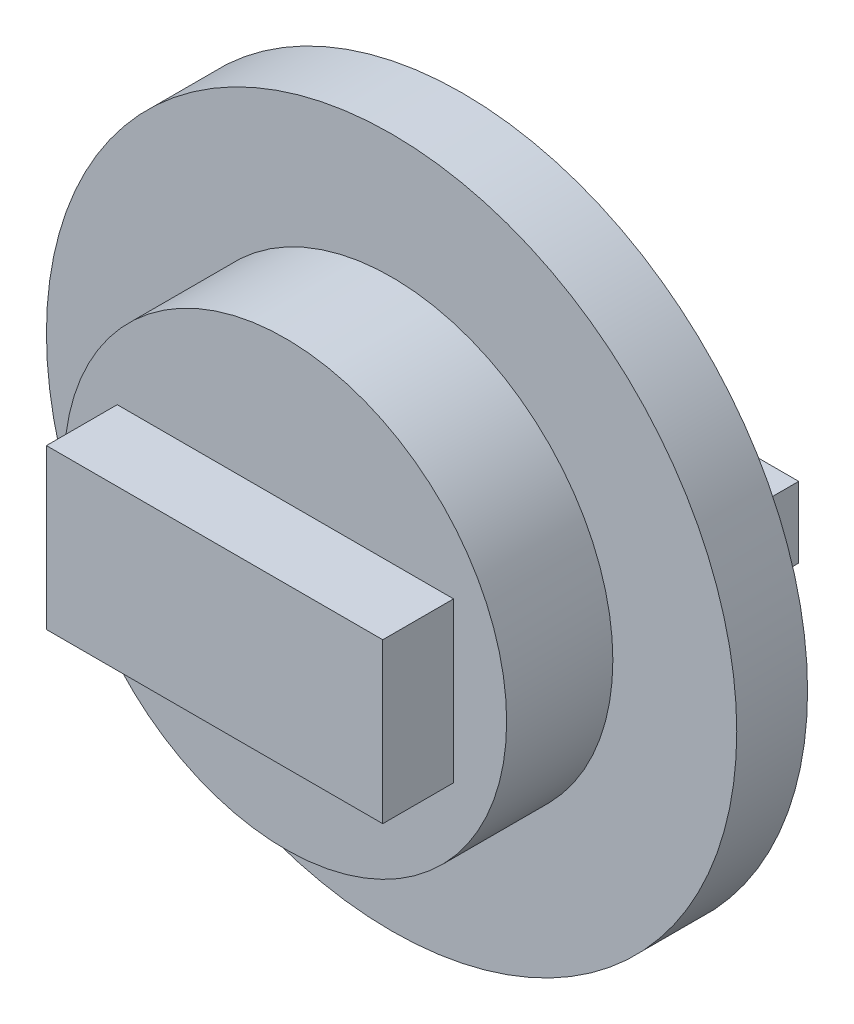
from build123d import *

# Parameters (mm, degrees)
SKETCH_1_R      = 9.75
EXTRUDE_1_DEPTH = 2
EXTRUDE_START   = 2
SKETCH_2_R      = 6.25
EXTRUDE_2_DEPTH = 3
EXTRUDE_START_2 = 5
SKETCH_3_W      = 9.5
SKETCH_3_H      = 4.5
EXTRUDE_3_DEPTH = 2
SKETCH_4_W      = 15
SKETCH_4_H      = 2
EXTRUDE_4_DEPTH = 2


with BuildPart() as part:
    # Эскиз1 → Бобышка-Вытянуть1 (new body)
    with BuildSketch(Plane.XY):
        Circle(SKETCH_1_R)
    extrude(amount=EXTRUDE_1_DEPTH)

    # Эскиз2 → Бобышка-Вытянуть2 (add)
    with BuildSketch(Plane.XY.offset(EXTRUDE_START)):
        Circle(SKETCH_2_R)
    extrude(amount=EXTRUDE_2_DEPTH)

    # Эскиз3 → Бобышка-Вытянуть3 (add)
    with BuildSketch(Plane.XY.offset(EXTRUDE_START_2)):
        Rectangle(SKETCH_3_W, SKETCH_3_H)
    extrude(amount=EXTRUDE_3_DEPTH)

    # Эскиз4 → Бобышка-Вытянуть4 (add)
    with BuildSketch(Plane.XY):
        with Locations((0, 2)):
            Rectangle(SKETCH_4_W, SKETCH_4_H)
        with Locations((0, -2)):
            Rectangle(SKETCH_4_W, SKETCH_4_H)
    extrude(amount=-EXTRUDE_4_DEPTH)


solid = part.part
